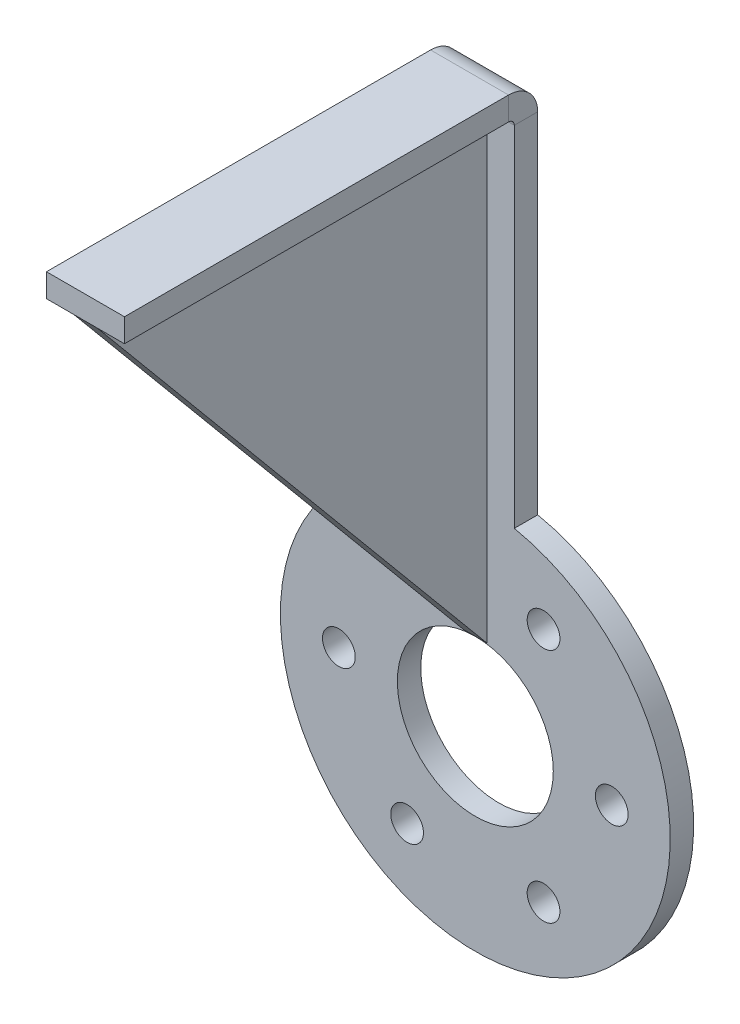
from build123d import *

# Parameters (mm, degrees)
BASE_FLANGE2_START           = -3
BASE_FLANGE2_OUTLINE_R       = 10
BASE_FLANGE2_DEPTH           = 3
EDGE_FLANGE1_STRIP_W         = 13.4732
EDGE_FLANGE1_STRIP_H         = 3
EDGE_FLANGE1_STRIP_CUT_DEPTH = 10
EDGE_FLANGE1_DEPTH           = 10
BOSS_EXTRUDE1_START          = -3.5
BOSS_EXTRUDE1_DEPTH          = 3
TAP_DRILL_FOR_M5X0_8_TAP2_D  = 4.2
CIRPATTERN2_COUNT            = 6


# Read off the part's stored shape, not the designer's step: Base-Flange2
# Sheet-metal steps are written as plain solids
with BuildPart() as part:
    # Base-Flange2 outline → Base-Flange2 (new body)
    with BuildSketch(Plane.XY.offset(BASE_FLANGE2_START)):
        with BuildLine():
            Line((5, 70), (-5, 70))
            Line((-5, 70), (-5, 24.494897428))
            ThreePointArc((-5, 24.494897428), (0, -25), (5, 24.494897428))
            Line((5, 24.494897428), (5, 70))
        make_face()
        Circle(BASE_FLANGE2_OUTLINE_R, mode=Mode.SUBTRACT)
    extrude(amount=BASE_FLANGE2_DEPTH)

    # Edge-Flange1 strip (across the edge) → Edge-Flange1 strip cut (cut)
    with BuildSketch(Plane(origin=(5, 70, 0), x_dir=(0, -1, 0), z_dir=(-1, 0, 0))):
        with Locations((-6, -1.5)):
            Rectangle(EDGE_FLANGE1_STRIP_W, EDGE_FLANGE1_STRIP_H)
    extrude(amount=EDGE_FLANGE1_STRIP_CUT_DEPTH, mode=Mode.SUBTRACT)

    # Edge-Flange1 section (across the edge) → Edge-Flange1 (add)
    with BuildSketch(Plane(origin=(5, 70, 0), x_dir=(0, -1, 0), z_dir=(-1, 0, 0))):
        with BuildLine():
            Line((-3, 0.7366), (-3, 50))
            Line((-3, 50), (0, 50))
            Line((0, 50), (0, 0.7366))
            ThreePointArc((0, 0.7366), (0.215745145, 0.215745145), (0.7366, 0))
            Line((0.7366, 0), (0.7366, -3))
            ThreePointArc((0.7366, -3), (-1.905575199, -1.905575199), (-3, 0.7366))
        make_face()
    extrude(amount=EDGE_FLANGE1_DEPTH)

    # Sketch13 → Boss-Extrude1 (add)
    with BuildSketch(Plane(origin=(5, 0, 0), x_dir=(0, 0, -1), z_dir=(1, 0, 0)).offset(BOSS_EXTRUDE1_START)):
        with BuildLine():
            Line((-50, 70), (-0.74, 70))
            ThreePointArc((-0.74, 70), (-0.216740982, 69.783259018), (0, 69.26))
            Line((0, 69.26), (0, 10))
            Line((0, 10), (-50, 70))
        make_face()
    extrude(amount=-BOSS_EXTRUDE1_DEPTH)

    # Tap Drill for M5x0.8 Tap2 (through all)
    with Locations(Plane.XY):
        with Locations((17.5, 0)):
            tap_drill_for_m5x0_8_tap2 = Hole(TAP_DRILL_FOR_M5X0_8_TAP2_D / 2)

    # CirPattern2: Tap Drill for M5x0.8 Tap2 ×6 about axis
    cirpattern2_axis = Axis((0, 0, 0), (0, 0, 1))
    for i in range(1, CIRPATTERN2_COUNT):
        add(tap_drill_for_m5x0_8_tap2.rotate(cirpattern2_axis, i * 360 / CIRPATTERN2_COUNT), mode=Mode.SUBTRACT)


solid = part.part
